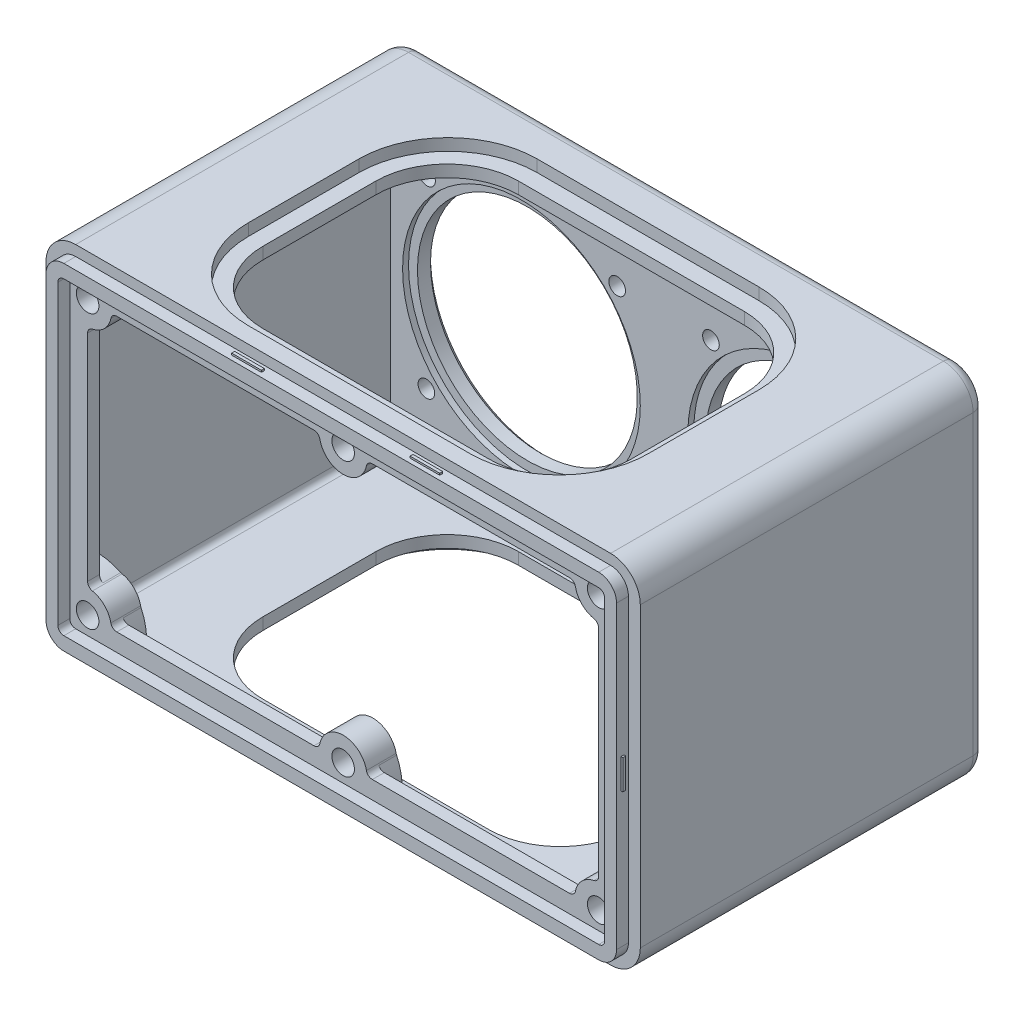
from build123d import *

# Parameters (mm, degrees)
SKETCH_1_W          = 100
SKETCH_1_H          = 60
EXTRUDE_2_DEPTH     = 60
FILLET_1_R          = 5
SHELL_2_T           = -4
FILLET_3_R          = 2
CUT_EXTRUDE_1_REACH = 85.666
SKETCH_2_R          = 18
SKETCH_2_R_2        = 18.5
CUT_EXTRUDE_2_REACH = 100.489
CUT_EXTRUDE_3_DEPTH = 2
CUT_EXTRUDE_START   = -2
CUT_EXTRUDE_4_DEPTH = 2
CUT_EXTRUDE_5_REACH = 85.666
SKETCH_6_R          = 1.4
SKETCH_7_OUTSIDE_W  = 128.23
SKETCH_7_OUTSIDE_H  = 88.23
CUT_EXTRUDE_6_DEPTH = 2
SKETCH_8_W          = 5
SKETCH_8_H          = 0.5
EXTRUDE_3_DEPTH     = 0.3
SKETCH_9_W          = 5
SKETCH_9_H          = 0.5
EXTRUDE_4_DEPTH     = 0.3
SKETCH_10_W         = 0.5
SKETCH_10_H         = 5
EXTRUDE_5_DEPTH     = 0.3
SKETCH_11_W         = 0.5
SKETCH_11_H         = 5
EXTRUDE_6_DEPTH     = 0.3
SKETCH_13_R         = 20
CUT_EXTRUDE_8_DEPTH = 1
EXTRUDE_7_DEPTH     = 2
EXTRUDE_10_DEPTH    = 3
EXTRUDE_11_DEPTH    = 3
EXTRUDE_12_DEPTH    = 3
EXTRUDE_13_DEPTH    = 3
EXTRUDE_14_DEPTH    = 3
EXTRUDE_15_DEPTH    = 3
FILLET_4_R          = 10
CUT_EXTRUDE_9_REACH = 84.244
SKETCH_28_R         = 1.9
CHAMFER_1_SIZE      = 0.8


with BuildPart() as part:
    # 草图1 → 凸台-拉伸2 (new body)
    with BuildSketch(Plane.XY):
        Rectangle(SKETCH_1_W, SKETCH_1_H)
    extrude(amount=EXTRUDE_2_DEPTH)

    # 圆角1
    fillet_1_edges = [part.edges().sort_by_distance(p)[0] for p in [
        (50, -30, 30),
        (-50, -30, 30),
        (-50, 30, 30),
        (50, 30, 30),
    ]]
    fillet(fillet_1_edges, radius=FILLET_1_R)

    # 抽壳2
    shell_2_openings = [part.faces().sort_by_distance(p)[0] for p in [
        (0, 0, 60),
    ]]
    offset(amount=SHELL_2_T, openings=shell_2_openings, kind=Kind.INTERSECTION)

    # 圆角3
    fillet_3_edges = [part.edges().sort_by_distance(p)[0] for p in [
        (50, 0, 0),
        (0, -30, 0),
        (-50, 0, 0),
        (0, 30, 0),
        (-48.535533906, -28.535533906, 0),
        (-48.535533906, 28.535533906, 0),
        (48.535533906, 28.535533906, 0),
        (48.535533906, -28.535533906, 0),
    ]]
    fillet(fillet_3_edges, radius=FILLET_3_R)

    # 草图2 → 切除-拉伸1 (cut, up to next)
    with BuildSketch(Plane(origin=(0, 0, 0), x_dir=(-1, 0, 0), z_dir=(0, 0, -1)), mode=Mode.PRIVATE) as cut_extrude_1_sk1:
        with Locations((-24, 0)):
            Circle(SKETCH_2_R)
    cut_extrude_1_tool1 = extrude(cut_extrude_1_sk1.sketch, amount=-CUT_EXTRUDE_1_REACH, mode=Mode.PRIVATE) & part.part
    # 草图2 → 切除-拉伸1 (cut, up to next)
    with BuildSketch(Plane(origin=(0, 0, 0), x_dir=(-1, 0, 0), z_dir=(0, 0, -1)), mode=Mode.PRIVATE) as cut_extrude_1_sk2:
        with Locations((24, 0)):
            Circle(SKETCH_2_R_2)
    cut_extrude_1_tool2 = extrude(cut_extrude_1_sk2.sketch, amount=-CUT_EXTRUDE_1_REACH, mode=Mode.PRIVATE) & part.part
    add(cut_extrude_1_tool1.solids().sort_by_distance((24, 0, 0))[0], mode=Mode.SUBTRACT)
    add(cut_extrude_1_tool2.solids().sort_by_distance((-24, 0, 0))[0], mode=Mode.SUBTRACT)

    # 切除-拉伸2: up to this face of the body (flat: up to its plane)
    cut_extrude_2_end = Plane(part.part.faces().sort_by_distance((0, 30, 31))[0])
    # 草图3 → 切除-拉伸2 (cut, up to the picked face)
    with BuildSketch(Plane.XZ.offset(30), mode=Mode.PRIVATE) as cut_extrude_2_sk1:
        with BuildLine():
            Line((19, 52.5), (-19, 52.5))
            ThreePointArc((-19, 52.5), (-27.485281374, 48.985281374), (-31, 40.5))
            Line((-31, 40.5), (-31, 21.5))
            ThreePointArc((-31, 21.5), (-27.485281374, 13.014718626), (-19, 9.5))
            Line((-19, 9.5), (19, 9.5))
            ThreePointArc((19, 9.5), (27.485281374, 13.014718626), (31, 21.5))
            Line((31, 21.5), (31, 40.5))
            ThreePointArc((31, 40.5), (27.485281374, 48.985281374), (19, 52.5))
        make_face()
    cut_extrude_2_tool1 = split(extrude(cut_extrude_2_sk1.sketch, amount=-CUT_EXTRUDE_2_REACH, mode=Mode.PRIVATE), bisect_by=cut_extrude_2_end, keep=Keep.BOTH, mode=Mode.PRIVATE)
    add(cut_extrude_2_tool1.solids().sort_by(Axis((0, -30, 31), (0, 1, 0)))[0], mode=Mode.SUBTRACT)

    # 草图4 → 切除-拉伸3 (cut)
    with BuildSketch(Plane.XZ.offset(30)):
        with BuildLine():
            Line((18.65, 55.3), (-18.65, 55.3))
            ThreePointArc((-18.65, 55.3), (-29.256601718, 50.906601718), (-33.65, 40.3))
            Line((-33.65, 40.3), (-33.65, 21.7))
            ThreePointArc((-33.65, 21.7), (-29.256601718, 11.093398282), (-18.65, 6.7))
            Line((-18.65, 6.7), (18.65, 6.7))
            ThreePointArc((18.65, 6.7), (29.256601718, 11.093398282), (33.65, 21.7))
            Line((33.65, 21.7), (33.65, 40.3))
            ThreePointArc((33.65, 40.3), (29.256601718, 50.906601718), (18.65, 55.3))
        make_face()
    extrude(amount=-CUT_EXTRUDE_3_DEPTH, mode=Mode.SUBTRACT)

    # 草图5 → 切除-拉伸4 (cut)
    with BuildSketch(Plane(origin=(0, 30, 0), x_dir=(1, 0, 0), z_dir=(0, 1, 0)).offset(CUT_EXTRUDE_START)):
        with BuildLine():
            Line((-33.65, -40.3), (-33.65, -21.7))
            ThreePointArc((-33.65, -21.7), (-29.256601718, -11.093398282), (-18.65, -6.7))
            Line((-18.65, -6.7), (18.65, -6.7))
            ThreePointArc((18.65, -6.7), (29.256601718, -11.093398282), (33.65, -21.7))
            Line((33.65, -21.7), (33.65, -40.3))
            ThreePointArc((33.65, -40.3), (29.256601718, -50.906601718), (18.65, -55.3))
            Line((18.65, -55.3), (-18.65, -55.3))
            ThreePointArc((-18.65, -55.3), (-29.256601718, -50.906601718), (-33.65, -40.3))
        make_face()
    extrude(amount=CUT_EXTRUDE_4_DEPTH, mode=Mode.SUBTRACT)

    # 草图6 → 切除-拉伸5 (cut, up to next)
    with BuildSketch(Plane(origin=(0, 0, 0), x_dir=(-1, 0, 0), z_dir=(0, 0, -1)), mode=Mode.PRIVATE) as cut_extrude_5_sk1:
        with Locations((-39.887301628, 15.5)):
            Circle(SKETCH_6_R)
    cut_extrude_5_tool1 = extrude(cut_extrude_5_sk1.sketch, amount=-CUT_EXTRUDE_5_REACH, mode=Mode.PRIVATE) & part.part
    # 草图6 → 切除-拉伸5 (cut, up to next)
    with BuildSketch(Plane(origin=(0, 0, 0), x_dir=(-1, 0, 0), z_dir=(0, 0, -1)), mode=Mode.PRIVATE) as cut_extrude_5_sk2:
        with Locations((-40, -15.5)):
            Circle(SKETCH_6_R)
    cut_extrude_5_tool2 = extrude(cut_extrude_5_sk2.sketch, amount=-CUT_EXTRUDE_5_REACH, mode=Mode.PRIVATE) & part.part
    # 草图6 → 切除-拉伸5 (cut, up to next)
    with BuildSketch(Plane(origin=(0, 0, 0), x_dir=(-1, 0, 0), z_dir=(0, 0, -1)), mode=Mode.PRIVATE) as cut_extrude_5_sk3:
        with Locations((-8, -15.5)):
            Circle(SKETCH_6_R)
    cut_extrude_5_tool3 = extrude(cut_extrude_5_sk3.sketch, amount=-CUT_EXTRUDE_5_REACH, mode=Mode.PRIVATE) & part.part
    # 草图6 → 切除-拉伸5 (cut, up to next)
    with BuildSketch(Plane(origin=(0, 0, 0), x_dir=(-1, 0, 0), z_dir=(0, 0, -1)), mode=Mode.PRIVATE) as cut_extrude_5_sk4:
        with Locations((-7.887301628, 15.5)):
            Circle(SKETCH_6_R)
    cut_extrude_5_tool4 = extrude(cut_extrude_5_sk4.sketch, amount=-CUT_EXTRUDE_5_REACH, mode=Mode.PRIVATE) & part.part
    # 草图6 → 切除-拉伸5 (cut, up to next)
    with BuildSketch(Plane(origin=(0, 0, 0), x_dir=(-1, 0, 0), z_dir=(0, 0, -1)), mode=Mode.PRIVATE) as cut_extrude_5_sk5:
        with Locations(Location((8, -15.5, 0), (0, 0, 180))):
            Circle(SKETCH_6_R)
    cut_extrude_5_tool5 = extrude(cut_extrude_5_sk5.sketch, amount=-CUT_EXTRUDE_5_REACH, mode=Mode.PRIVATE) & part.part
    # 草图6 → 切除-拉伸5 (cut, up to next)
    with BuildSketch(Plane(origin=(0, 0, 0), x_dir=(-1, 0, 0), z_dir=(0, 0, -1)), mode=Mode.PRIVATE) as cut_extrude_5_sk6:
        with Locations(Location((40, -15.5, 0), (0, 0, 180))):
            Circle(SKETCH_6_R)
    cut_extrude_5_tool6 = extrude(cut_extrude_5_sk6.sketch, amount=-CUT_EXTRUDE_5_REACH, mode=Mode.PRIVATE) & part.part
    # 草图6 → 切除-拉伸5 (cut, up to next)
    with BuildSketch(Plane(origin=(0, 0, 0), x_dir=(-1, 0, 0), z_dir=(0, 0, -1)), mode=Mode.PRIVATE) as cut_extrude_5_sk7:
        with Locations(Location((7.887301628, 15.5, 0), (0, 0, 180))):
            Circle(SKETCH_6_R)
    cut_extrude_5_tool7 = extrude(cut_extrude_5_sk7.sketch, amount=-CUT_EXTRUDE_5_REACH, mode=Mode.PRIVATE) & part.part
    # 草图6 → 切除-拉伸5 (cut, up to next)
    with BuildSketch(Plane(origin=(0, 0, 0), x_dir=(-1, 0, 0), z_dir=(0, 0, -1)), mode=Mode.PRIVATE) as cut_extrude_5_sk8:
        with Locations(Location((39.887301628, 15.5, 0), (0, 0, 180))):
            Circle(SKETCH_6_R)
    cut_extrude_5_tool8 = extrude(cut_extrude_5_sk8.sketch, amount=-CUT_EXTRUDE_5_REACH, mode=Mode.PRIVATE) & part.part
    add(cut_extrude_5_tool1.solids().sort_by_distance((39.887302, 15.5, 0))[0], mode=Mode.SUBTRACT)
    add(cut_extrude_5_tool2.solids().sort_by_distance((40, -15.5, 0))[0], mode=Mode.SUBTRACT)
    add(cut_extrude_5_tool3.solids().sort_by_distance((8, -15.5, 0))[0], mode=Mode.SUBTRACT)
    add(cut_extrude_5_tool4.solids().sort_by_distance((7.887302, 15.5, 0))[0], mode=Mode.SUBTRACT)
    add(cut_extrude_5_tool5.solids().sort_by_distance((-8, -15.5, 0))[0], mode=Mode.SUBTRACT)
    add(cut_extrude_5_tool6.solids().sort_by_distance((-40, -15.5, 0))[0], mode=Mode.SUBTRACT)
    add(cut_extrude_5_tool7.solids().sort_by_distance((-7.887302, 15.5, 0))[0], mode=Mode.SUBTRACT)
    add(cut_extrude_5_tool8.solids().sort_by_distance((-39.887302, 15.5, 0))[0], mode=Mode.SUBTRACT)

    # 草图7 outside → 切除-拉伸6 (cut)
    with BuildSketch(Plane.XY.offset(60)):
        Rectangle(SKETCH_7_OUTSIDE_W, SKETCH_7_OUTSIDE_H)
        with BuildLine():
            Line((45, 28.25), (-45, 28.25))
            ThreePointArc((-45, 28.25), (-47.121320344, 27.371320344), (-48, 25.25))
            Line((-48, 25.25), (-48, -25.25))
            ThreePointArc((-48, -25.25), (-47.121320344, -27.371320344), (-45, -28.25))
            Line((-45, -28.25), (45, -28.25))
            ThreePointArc((45, -28.25), (47.121320344, -27.371320344), (48, -25.25))
            Line((48, -25.25), (48, 25.25))
            ThreePointArc((48, 25.25), (47.121320344, 27.371320344), (45, 28.25))
        make_face(mode=Mode.SUBTRACT)
    extrude(amount=-CUT_EXTRUDE_6_DEPTH, mode=Mode.SUBTRACT)

    # 草图8 → 凸台-拉伸3 (add)
    with BuildSketch(Plane.XZ.offset(28.25)):
        with Locations((15, 59)):
            Rectangle(SKETCH_8_W, SKETCH_8_H)
        with Locations((-15, 59)):
            Rectangle(SKETCH_8_W, SKETCH_8_H)
    extrude(amount=EXTRUDE_3_DEPTH)

    # 草图9 → 凸台-拉伸4 (add)
    with BuildSketch(Plane(origin=(0, 28.25, 0), x_dir=(1, 0, 0), z_dir=(0, 1, 0))):
        with Locations((-15, -59)):
            Rectangle(SKETCH_9_W, SKETCH_9_H)
        with Locations((15, -59)):
            Rectangle(SKETCH_9_W, SKETCH_9_H)
    extrude(amount=EXTRUDE_4_DEPTH)

    # 草图10 → 凸台-拉伸5 (add)
    with BuildSketch(Plane(origin=(48, 0, 0), x_dir=(0, 0, -1), z_dir=(1, 0, 0))):
        with Locations((-59, 0)):
            Rectangle(SKETCH_10_W, SKETCH_10_H)
    extrude(amount=EXTRUDE_5_DEPTH)

    # 草图11 → 凸台-拉伸6 (add)
    with BuildSketch(Plane.ZY.offset(48)):
        with Locations((59, 0)):
            Rectangle(SKETCH_11_W, SKETCH_11_H)
    extrude(amount=EXTRUDE_6_DEPTH)

    # 草图13 → 切除-拉伸8 (cut)
    with BuildSketch(Plane.XY.offset(4)):
        with Locations((24, 0)):
            Circle(SKETCH_13_R)
        with Locations(Location((-24, 0, 0), (0, 0, 180))):
            Circle(SKETCH_13_R)
    extrude(amount=-CUT_EXTRUDE_8_DEPTH, mode=Mode.SUBTRACT)

    # 草图16 → 凸台-拉伸7 (add)
    with BuildSketch(Plane.XY.offset(58)):
        with BuildLine():
            Line((45, 26), (-45, 26))
            ThreePointArc((-45, 26), (-45.707106781, 25.707106781), (-46, 25))
            Line((-46, 25), (-46, -25))
            ThreePointArc((-46, -25), (-45.707106781, -25.707106781), (-45, -26))
            Line((-45, -26), (45, -26))
            ThreePointArc((45, -26), (45.707106781, -25.707106781), (46, -25))
            Line((46, -25), (46, 25))
            ThreePointArc((46, 25), (45.707106781, 25.707106781), (45, 26))
        make_face()
        with BuildLine():
            Line((38.088284978, 23), (4.911715022, 23))
            ThreePointArc((4.911715022, 23), (4.270382619, 22.771892442), (3.917136405, 22.190035568))
            ThreePointArc((3.917136405, 22.190035568), (0, 19), (-3.917136405, 22.190035568))
            ThreePointArc((-3.917136405, 22.190035568), (-4.270382619, 22.771892442), (-4.911715022, 23))
            Line((-4.911715022, 23), (-38.088284978, 23))
            ThreePointArc((-38.088284978, 23), (-38.729617381, 22.771892442), (-39.082863594, 22.190035568))
            ThreePointArc((-39.082863594, 22.190035568), (-40.171572875, 20.171572875), (-42.190035568, 19.082863595))
            ThreePointArc((-42.190035568, 19.082863595), (-42.771892442, 18.729617381), (-43, 18.088284978))
            Line((-43, 18.088284978), (-43, -18.088284978))
            ThreePointArc((-43, -18.088284978), (-42.771892442, -18.729617381), (-42.190035568, -19.082863595))
            ThreePointArc((-42.190035568, -19.082863595), (-40.171572875, -20.171572875), (-39.082863594, -22.190035568))
            ThreePointArc((-39.082863594, -22.190035568), (-38.729617381, -22.771892442), (-38.088284978, -23))
            Line((-38.088284978, -23), (-4.911715022, -23))
            ThreePointArc((-4.911715022, -23), (-4.270382619, -22.771892442), (-3.917136405, -22.190035568))
            ThreePointArc((-3.917136405, -22.190035568), (0, -19), (3.917136405, -22.190035568))
            ThreePointArc((3.917136405, -22.190035568), (4.270382619, -22.771892442), (4.911715022, -23))
            Line((4.911715022, -23), (38.088284978, -23))
            ThreePointArc((38.088284978, -23), (38.729617381, -22.771892442), (39.082863594, -22.190035568))
            ThreePointArc((39.082863594, -22.190035568), (40.171572875, -20.171572875), (42.190035568, -19.082863595))
            ThreePointArc((42.190035568, -19.082863595), (42.771892442, -18.729617381), (43, -18.088284978))
            Line((43, -18.088284978), (43, 18.088284978))
            ThreePointArc((43, 18.088284978), (42.771892442, 18.729617381), (42.190035568, 19.082863595))
            ThreePointArc((42.190035568, 19.082863595), (40.171572875, 20.171572875), (39.082863595, 22.190035568))
            ThreePointArc((39.082863595, 22.190035568), (38.729617381, 22.771892442), (38.088284978, 23))
        make_face(mode=Mode.SUBTRACT)
    extrude(amount=-EXTRUDE_7_DEPTH)

    # 草图21 → 凸台-拉伸10 (add)
    with BuildSketch(Plane(origin=(0, 0, 56), x_dir=(-1, 0, 0), z_dir=(0, 0, -1))):
        with BuildLine():
            Line((45, -26), (38.088284978, -26))
            Line((38.088284978, -26), (38.088284978, -23))
            ThreePointArc((38.088284978, -23), (38.729617381, -22.771892442), (39.082863594, -22.190035568))
            ThreePointArc((39.082863594, -22.190035568), (40.171572875, -20.171572875), (42.190035568, -19.082863595))
            ThreePointArc((42.190035568, -19.082863595), (42.771892442, -18.729617381), (43, -18.088284978))
            Line((43, -18.088284978), (46, -18.088284978))
            Line((46, -18.088284978), (46, -25))
            ThreePointArc((46, -25), (45.707106781, -25.707106781), (45, -26))
        make_face()
    extrude(amount=EXTRUDE_10_DEPTH)

    # 草图22 → 凸台-拉伸11 (add)
    with BuildSketch(Plane(origin=(0, 0, 56), x_dir=(-1, 0, 0), z_dir=(0, 0, -1))):
        with BuildLine():
            Line((4.911715022, -23), (4.911715022, -26))
            Line((4.911715022, -26), (-4.911715022, -26))
            Line((-4.911715022, -26), (-4.911715022, -23))
            ThreePointArc((-4.911715022, -23), (-4.270382619, -22.771892442), (-3.917136405, -22.190035568))
            ThreePointArc((-3.917136405, -22.190035568), (0, -19), (3.917136405, -22.190035568))
            ThreePointArc((3.917136405, -22.190035568), (4.270382619, -22.771892442), (4.911715022, -23))
        make_face()
    extrude(amount=EXTRUDE_11_DEPTH)

    # 草图23 → 凸台-拉伸12 (add)
    with BuildSketch(Plane(origin=(0, 0, 56), x_dir=(-1, 0, 0), z_dir=(0, 0, -1))):
        with BuildLine():
            Line((-38.088284978, -26), (-45, -26))
            ThreePointArc((-45, -26), (-45.707106781, -25.707106781), (-46, -25))
            Line((-46, -25), (-46, -18.088284978))
            Line((-46, -18.088284978), (-43, -18.088284978))
            ThreePointArc((-43, -18.088284978), (-42.771892442, -18.729617381), (-42.190035568, -19.082863595))
            ThreePointArc((-42.190035568, -19.082863595), (-40.171572875, -20.171572875), (-39.082863594, -22.190035568))
            ThreePointArc((-39.082863594, -22.190035568), (-38.729617381, -22.771892442), (-38.088284978, -23))
            Line((-38.088284978, -23), (-38.088284978, -26))
        make_face()
    extrude(amount=EXTRUDE_12_DEPTH)

    # 草图24 → 凸台-拉伸13 (add)
    with BuildSketch(Plane(origin=(0, 0, 56), x_dir=(-1, 0, 0), z_dir=(0, 0, -1))):
        with BuildLine():
            Line((-43, 18.088284978), (-46, 18.088284978))
            Line((-46, 18.088284978), (-46, 25))
            ThreePointArc((-46, 25), (-45.707106781, 25.707106781), (-45, 26))
            Line((-45, 26), (-38.088284978, 26))
            Line((-38.088284978, 26), (-38.088284978, 23))
            ThreePointArc((-38.088284978, 23), (-38.729617381, 22.771892442), (-39.082863595, 22.190035568))
            ThreePointArc((-39.082863595, 22.190035568), (-40.171572875, 20.171572875), (-42.190035568, 19.082863595))
            ThreePointArc((-42.190035568, 19.082863595), (-42.771892442, 18.729617381), (-43, 18.088284978))
        make_face()
    extrude(amount=EXTRUDE_13_DEPTH)

    # 草图26 → 凸台-拉伸14 (add)
    with BuildSketch(Plane(origin=(0, 0, 56), x_dir=(-1, 0, 0), z_dir=(0, 0, -1))):
        with BuildLine():
            Line((4.911715022, 23), (4.911715022, 26))
            Line((4.911715022, 26), (-4.911715022, 26))
            Line((-4.911715022, 26), (-4.911715022, 23))
            ThreePointArc((-4.911715022, 23), (-4.270382619, 22.771892442), (-3.917136405, 22.190035568))
            ThreePointArc((-3.917136405, 22.190035568), (0, 19), (3.917136405, 22.190035568))
            ThreePointArc((3.917136405, 22.190035568), (4.270382619, 22.771892442), (4.911715022, 23))
        make_face()
    extrude(amount=EXTRUDE_14_DEPTH)

    # 草图27 → 凸台-拉伸15 (add)
    with BuildSketch(Plane(origin=(0, 0, 56), x_dir=(-1, 0, 0), z_dir=(0, 0, -1))):
        with BuildLine():
            Line((38.088284978, 26), (45, 26))
            ThreePointArc((45, 26), (45.707106781, 25.707106781), (46, 25))
            Line((46, 25), (46, 18.088284978))
            Line((46, 18.088284978), (43, 18.088284978))
            ThreePointArc((43, 18.088284978), (42.771892442, 18.729617381), (42.190035568, 19.082863595))
            ThreePointArc((42.190035568, 19.082863595), (40.171572875, 20.171572875), (39.082863594, 22.190035568))
            ThreePointArc((39.082863594, 22.190035568), (38.729617381, 22.771892442), (38.088284978, 23))
            Line((38.088284978, 23), (38.088284978, 26))
        make_face()
    extrude(amount=EXTRUDE_15_DEPTH)

    # 圆角4
    # the kernel refuses this fillet: 10 mm, written as the material it takes off along each edge
    with BuildSketch(Plane(origin=(38.088284978, 23, 56), x_dir=(0.8436607961181475, -0.5368765790135509, 0), z_dir=(0, 0, -1)), Plane(origin=(43, -18.088284978, 56), x_dir=(-0.536876579013838, -0.8436607961179646, 0), z_dir=(0, 0, -1)), Plane(origin=(4.911715022, -23, 56), x_dir=(-0.8436607961192291, 0.5368765790118516, 0), z_dir=(0, 0, -1)), Plane(origin=(-43, 18.088284978, 56), x_dir=(0.5368765790157093, 0.8436607961167739, 0), z_dir=(0, 0, -1)), Plane(origin=(-4.911715022, 23, 56), x_dir=(0.843660796105409, -0.5368765790335683, 0), z_dir=(0, 0, -1))) as fillet_4_piece_1:
        with BuildLine():
            CenterArc((6.459288887, -8.436607961), FILLET_4_R, 122.4712661, 21.331794759)
            Line((-1.610629737, -2.530982388), (0, 0))
            ThreePointArc((0, 0), (0.545261548, -0.158780919), (1.090523097, 0))
        make_face()
    extrude(amount=10.5, mode=Mode.SUBTRACT)
    with BuildSketch(Plane(origin=(43, 18.088284978, 56), x_dir=(1, 0, 0), z_dir=(0, 0, -1)), Plane(origin=(38.088284978, -23, 56), x_dir=(9.009681889438028e-12, -1.0, 0), z_dir=(0, 0, -1)), Plane(origin=(-4.911715022, -23, 56), x_dir=(0, -1, 0), z_dir=(0, 0, -1)), Plane(origin=(-43, -18.088284978, 56), x_dir=(-1, 0, 0), z_dir=(0, 0, -1))) as fillet_4_piece_2:
        with BuildLine():
            CenterArc((3.649794469, -9.978866025), FILLET_4_R, 93.72567304, 21.33179476)
            ThreePointArc((-0.585476309, -0.920031584), (-0.158780919, -0.545261548), (0, 0))
            Line((0, 0), (3, 0))
        make_face()
    extrude(amount=10.5, mode=Mode.SUBTRACT)
    with BuildSketch(Plane(origin=(-38.088284978, -23, 56), x_dir=(0, -1, 0), z_dir=(0, 0, -1))) as fillet_4_piece_3:
        with BuildLine():
            CenterArc((3.649794469, 9.978866025), FILLET_4_R, 244.942532201, 21.331794759)
            ThreePointArc((-0.585476309, 0.920031584), (-0.158780919, 0.545261548), (0, 0))
            Line((0, 0), (3, 0))
        make_face()
    extrude(amount=10.5, mode=Mode.SUBTRACT)
    with BuildSketch(Plane(origin=(-38.088284978, 23, 56), x_dir=(-0.8436607961181445, -0.5368765790135556, 0), z_dir=(0, 0, -1)), Plane(origin=(4.911715022, 23, 56), x_dir=(-0.8436607961135666, -0.5368765790207495, 0), z_dir=(0, 0, -1))) as fillet_4_piece_4:
        with BuildLine():
            CenterArc((6.459288887, 8.436607961), FILLET_4_R, 216.196939141, 21.331794759)
            Line((-1.610629737, 2.530982388), (0, 0))
            ThreePointArc((0, 0), (0.545261548, 0.158780919), (1.090523097, 0))
        make_face()
    extrude(amount=10.5, mode=Mode.SUBTRACT)

    # 草图28 → 切除-拉伸9 (cut, up to next)
    with BuildSketch(Plane.XY.offset(58), mode=Mode.PRIVATE) as cut_extrude_9_sk1:
        with Locations((43, -23)):
            Circle(SKETCH_28_R)
    cut_extrude_9_tool1 = extrude(cut_extrude_9_sk1.sketch, amount=-CUT_EXTRUDE_9_REACH, mode=Mode.PRIVATE) & part.part
    # 草图28 → 切除-拉伸9 (cut, up to next)
    with BuildSketch(Plane.XY.offset(58), mode=Mode.PRIVATE) as cut_extrude_9_sk2:
        with Locations((43, 23)):
            Circle(SKETCH_28_R)
    cut_extrude_9_tool2 = extrude(cut_extrude_9_sk2.sketch, amount=-CUT_EXTRUDE_9_REACH, mode=Mode.PRIVATE) & part.part
    # 草图28 → 切除-拉伸9 (cut, up to next)
    with BuildSketch(Plane.XY.offset(58), mode=Mode.PRIVATE) as cut_extrude_9_sk3:
        with Locations((0, 23)):
            Circle(SKETCH_28_R)
    cut_extrude_9_tool3 = extrude(cut_extrude_9_sk3.sketch, amount=-CUT_EXTRUDE_9_REACH, mode=Mode.PRIVATE) & part.part
    # 草图28 → 切除-拉伸9 (cut, up to next)
    with BuildSketch(Plane.XY.offset(58), mode=Mode.PRIVATE) as cut_extrude_9_sk4:
        with Locations((0, -23)):
            Circle(SKETCH_28_R)
    cut_extrude_9_tool4 = extrude(cut_extrude_9_sk4.sketch, amount=-CUT_EXTRUDE_9_REACH, mode=Mode.PRIVATE) & part.part
    # 草图28 → 切除-拉伸9 (cut, up to next)
    with BuildSketch(Plane.XY.offset(58), mode=Mode.PRIVATE) as cut_extrude_9_sk5:
        with Locations((-43, 23)):
            Circle(SKETCH_28_R)
    cut_extrude_9_tool5 = extrude(cut_extrude_9_sk5.sketch, amount=-CUT_EXTRUDE_9_REACH, mode=Mode.PRIVATE) & part.part
    # 草图28 → 切除-拉伸9 (cut, up to next)
    with BuildSketch(Plane.XY.offset(58), mode=Mode.PRIVATE) as cut_extrude_9_sk6:
        with Locations((-43, -23)):
            Circle(SKETCH_28_R)
    cut_extrude_9_tool6 = extrude(cut_extrude_9_sk6.sketch, amount=-CUT_EXTRUDE_9_REACH, mode=Mode.PRIVATE) & part.part
    add(cut_extrude_9_tool1.solids().sort_by_distance((43, -23, 58))[0], mode=Mode.SUBTRACT)
    add(cut_extrude_9_tool2.solids().sort_by_distance((43, 23, 58))[0], mode=Mode.SUBTRACT)
    add(cut_extrude_9_tool3.solids().sort_by_distance((0, 23, 58))[0], mode=Mode.SUBTRACT)
    add(cut_extrude_9_tool4.solids().sort_by_distance((0, -23, 58))[0], mode=Mode.SUBTRACT)
    add(cut_extrude_9_tool5.solids().sort_by_distance((-43, 23, 58))[0], mode=Mode.SUBTRACT)
    add(cut_extrude_9_tool6.solids().sort_by_distance((-43, -23, 58))[0], mode=Mode.SUBTRACT)

    # 倒角1
    chamfer_1_edges = [part.edges().sort_by_distance(p)[0] for p in [
        (42, 0, 0),
        (-5.5, 0, 0),
    ]]
    chamfer(chamfer_1_edges, length=CHAMFER_1_SIZE)


solid = part.part
